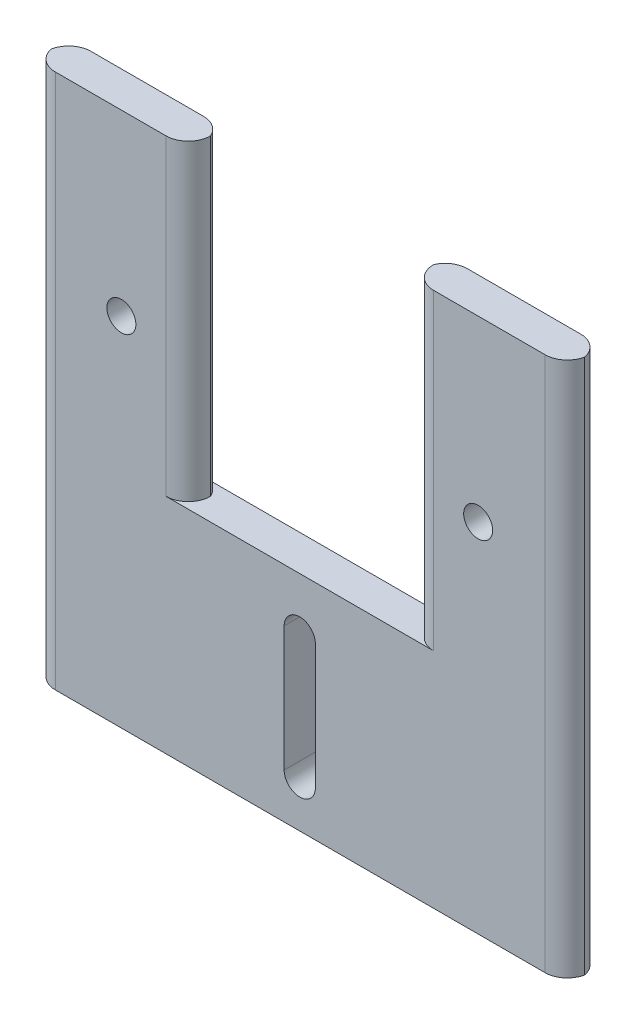
from build123d import *

# Parameters (mm, degrees)
SKETCH1_W           = 140
SKETCH1_H           = 120
BOSS_EXTRUDE1_DEPTH = 8
SKETCH2_R           = 3.25
CUT_EXTRUDE1_DEPTH  = 93.54188241
CUT_EXTRUDE2_DEPTH  = 93.54188241
SKETCH5_W           = 50
SKETCH5_H           = 70
CUT_EXTRUDE3_DEPTH  = 93.54188241
FILLET2_R           = 5
FILLET3_R           = 5
SKETCH6_W           = 10.179307593
SKETCH6_H           = 120.009276429
SKETCH6_W_2         = 10
SKETCH6_H_2         = 120
CUT_EXTRUDE4_DEPTH  = 93.54188241
FILLET4_R           = 5


with BuildPart() as part:
    # Sketch1 → Boss-Extrude1 (new body)
    with BuildSketch(Plane.XY):
        Rectangle(SKETCH1_W, SKETCH1_H)
    extrude(amount=BOSS_EXTRUDE1_DEPTH)

    # Sketch2 → Cut-Extrude1 (cut, through all)
    with BuildSketch(Plane.XY.offset(8)):
        with Locations((-40, 20)):
            Circle(SKETCH2_R)
        with Locations((40, 20)):
            Circle(SKETCH2_R)
    extrude(amount=-CUT_EXTRUDE1_DEPTH, mode=Mode.SUBTRACT)

    # Sketch3 → Cut-Extrude2 (cut, through all)
    with BuildSketch(Plane.XY.offset(8)):
        with BuildLine():
            Line((-3.5, -49.9), (-3.5, -21.9))
            ThreePointArc((-3.5, -21.9), (0, -18.4), (3.5, -21.9))
            Line((3.5, -21.9), (3.5, -49.9))
            ThreePointArc((3.5, -49.9), (0, -53.4), (-3.5, -49.9))
        make_face()
    extrude(amount=-CUT_EXTRUDE2_DEPTH, mode=Mode.SUBTRACT)

    # Sketch5 → Cut-Extrude3 (cut, through all)
    with BuildSketch(Plane.XY.offset(8)):
        with Locations((0, 25)):
            Rectangle(SKETCH5_W, SKETCH5_H)
    extrude(amount=-CUT_EXTRUDE3_DEPTH, mode=Mode.SUBTRACT)

    # Fillet2
    fillet2_edges = [part.edges().sort_by_distance(p)[0] for p in [
        (-25, 25, 8),
        (25, 25, 8),
    ]]
    fillet(fillet2_edges, radius=FILLET2_R)

    # Fillet3
    # the kernel refuses this fillet: 5 mm, written as the material it takes off along each edge
    with BuildSketch(Plane(origin=(25, -10, 0), x_dir=(1, 0, 0), z_dir=(0, 1, 0)), Plane(origin=(-25, 71.456439237, 0), x_dir=(-1, 0, 0), z_dir=(0, -1, 0))) as fillet3_piece_1:
        with BuildLine():
            CenterArc((4.582575695, -5), FILLET3_R, 90, 66.421821522)
            Line((0, -3), (-0.091651514, -2.96))
            ThreePointArc((-0.091651514, -2.96), (-0.1, -1.5), (-0.1, 0))
            Line((-0.1, 0), (0, 0.1))
            Line((0, 0.1), (4.582575695, 0.1))
            Line((4.582575695, 0.1), (4.582575695, 0))
        make_face()
    extrude(amount=81.456439237, mode=Mode.SUBTRACT)

    # Sketch6 → Cut-Extrude4 (cut, through all)
    with BuildSketch(Plane.XY.offset(8)):
        with Locations((-64.910346203, 0.004638214)):
            Rectangle(SKETCH6_W, SKETCH6_H)
        with Locations((65, 0)):
            Rectangle(SKETCH6_W_2, SKETCH6_H_2)
    extrude(amount=-CUT_EXTRUDE4_DEPTH, mode=Mode.SUBTRACT)

    # Fillet4
    # the kernel refuses this fillet: 5 mm, written as the material it takes off along each edge
    with BuildSketch(Plane(origin=(60, 72.5, 0), x_dir=(0, 0, 1), z_dir=(0, -1, 0)), Plane(origin=(-59.820692407, -72.5, 8), x_dir=(1, 0, 0), z_dir=(0, 1, 0))) as fillet4_piece_1:
        with BuildLine():
            CenterArc((FILLET4_R, FILLET4_R), FILLET4_R, 180, 90)
            Line((0, FILLET4_R), (0, 0))
            Line((0, 0), (FILLET4_R, 0))
        make_face()
    extrude(amount=145, mode=Mode.SUBTRACT)
    with BuildSketch(Plane(origin=(60, -72.5, 8), x_dir=(-1, 0, 0), z_dir=(0, 1, 0)), Plane(origin=(-59.820692407, 72.5, 0), x_dir=(0, 0, 1), z_dir=(0, -1, 0))) as fillet4_piece_2:
        with BuildLine():
            CenterArc((FILLET4_R, -FILLET4_R), FILLET4_R, 90, 90)
            Line((0, -FILLET4_R), (0, 0))
            Line((0, 0), (FILLET4_R, 0))
        make_face()
    extrude(amount=145, mode=Mode.SUBTRACT)


solid = part.part
